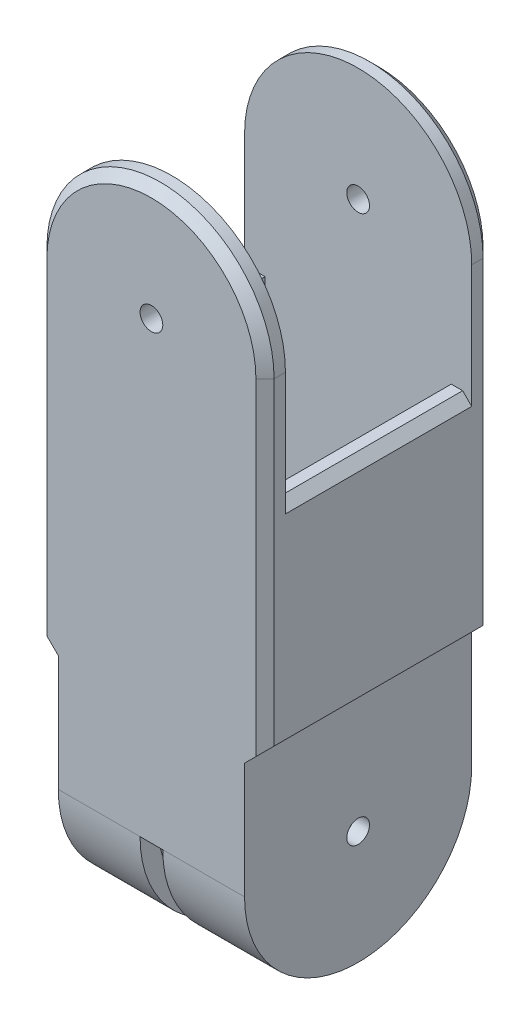
from build123d import *

# Parameters (mm, degrees)
SKETCH1_W               = 50
SKETCH1_H               = 50
BOSS_EXTRUDE1_DEPTH     = 100
SKETCH4_R               = 2.5
BOSS_EXTRUDE2_DEPTH     = 4.5
CUT_EXTRUDE1_DEPTH      = 161.078105936
CUT_EXTRUDE1_DEPTH_BACK = 161.078105936
SKETCH5_R               = 2.5
SKETCH6_W               = 50
SKETCH6_H               = 50
CUT_EXTRUDE2_DEPTH      = 4.5
CHAMFER1_SIZE           = 2
CHAMFER2_SIZE           = 5
SKETCH7_W               = 41
SKETCH7_H               = 41
CUT_EXTRUDE3_DEPTH      = 45
SKETCH8_W               = 34
SKETCH8_H               = 41
CUT_EXTRUDE4_DEPTH      = 30
CUT_EXTRUDE5_DEPTH      = 34
SKETCH10_W              = 5
SKETCH10_H              = 50.266184812
CUT_EXTRUDE6_DEPTH      = 25


with BuildPart() as part:
    # Sketch1 → Boss-Extrude1 (new body)
    with BuildSketch(Plane(origin=(0, 0, 0), x_dir=(1, 0, 0), z_dir=(0, 1, 0))):
        Rectangle(SKETCH1_W, SKETCH1_H)
    extrude(amount=BOSS_EXTRUDE1_DEPTH)

    # Sketch4 → Boss-Extrude2 (add)
    with BuildSketch(Plane(origin=(0, 0, -25), x_dir=(-1, 0, 0), z_dir=(0, 0, -1))):
        with BuildLine():
            Line((-25, 100), (25, 100))
            Line((25, 100), (25, 125))
            ThreePointArc((25, 125), (0, 150), (-25, 125))
            Line((-25, 125), (-25, 100))
        make_face()
        with Locations((0, 125)):
            Circle(SKETCH4_R, mode=Mode.SUBTRACT)
    boss_extrude2 = extrude(amount=-BOSS_EXTRUDE2_DEPTH)

    # Mirror2: Boss-Extrude2 across plane
    add(boss_extrude2.mirror(Plane.XY))

    # Sketch5 → Cut-Extrude1 (cut, two sides: drawn at the far end of the back side and taken through both)
    with BuildSketch(Plane.ZY.offset(-25).offset(-CUT_EXTRUDE1_DEPTH_BACK)):
        with BuildLine():
            Line((-25, 0), (2.6e-08, 0))
            ThreePointArc((2.6e-08, 0), (-17.67766952, 7.322330461), (-25, 25))
            Line((-25, 25), (-25, 0))
        make_face()
        with BuildLine():
            Line((25, 0), (25, 25))
            ThreePointArc((25, 25), (17.677669539, 7.32233048), (2.6e-08, 0))
            Line((2.6e-08, 0), (25, 0))
        make_face()
        with Locations((0, 25)):
            Circle(SKETCH5_R)
    extrude(amount=CUT_EXTRUDE1_DEPTH + CUT_EXTRUDE1_DEPTH_BACK, mode=Mode.SUBTRACT)

    # Sketch6 → Cut-Extrude2 (cut)
    with BuildSketch(Plane(origin=(25, 0, 0), x_dir=(0, 0, -1), z_dir=(1, 0, 0))):
        with Locations((0, 25)):
            Rectangle(SKETCH6_W, SKETCH6_H)
    cut_extrude2 = extrude(amount=-CUT_EXTRUDE2_DEPTH, mode=Mode.SUBTRACT)

    # Mirror3: Cut-Extrude2 across plane
    add(cut_extrude2.mirror(Plane(origin=(0, 0, 0), x_dir=(0, 0, 1), z_dir=(1, 0, 0))), mode=Mode.SUBTRACT)

    # Chamfer1
    chamfer1_edges = [part.edges().sort_by_distance(p)[0] for p in [
        (-25, 100, 0),
        (0, 150, -25),
        (25, 100, 0),
        (0, 150, 25),
        (25, 87.5, 25),
        (-25, 87.5, 25),
        (-25, 87.5, -25),
        (25, 87.5, -25),
    ]]
    chamfer(chamfer1_edges, length=CHAMFER1_SIZE)

    # Chamfer2
    # the kernel refuses this chamfer: 5 mm, written as the material it takes off along each edge
    with BuildSketch(Plane(origin=(25, 50, 35.85841494), x_dir=(0.027495876610586317, 0.9996219169112968, 0), z_dir=(0, 0, -1))) as chamfer2_piece_1_section:
        Polygon((CHAMFER2_SIZE * 0.999621916911, -CHAMFER2_SIZE * 0.0274958766106), (-CHAMFER2_SIZE * 0.0274958766106, -CHAMFER2_SIZE * 0.999621916911), (0, 0), align=None)
    chamfer2_piece_1 = extrude(amount=71.71682988, mode=Mode.PRIVATE)
    chamfer2_piece_1 = split(chamfer2_piece_1, bisect_by=Plane(origin=(20.5, 51.679503735, 0), z_dir=(1, 0, 0)), keep=Keep.TOP, mode=Mode.PRIVATE)
    add(chamfer2_piece_1, mode=Mode.SUBTRACT)
    with BuildSketch(Plane(origin=(-25, 50, 35.85841494), x_dir=(-0.027495876610586317, 0.9996219169112968, 0), z_dir=(0, 0, -1))) as chamfer2_piece_2_section:
        Polygon((CHAMFER2_SIZE * 0.999621916911, CHAMFER2_SIZE * 0.0274958766106), (-CHAMFER2_SIZE * 0.0274958766106, CHAMFER2_SIZE * 0.999621916911), (0, 0), align=None)
    chamfer2_piece_2 = extrude(amount=71.71682988, mode=Mode.PRIVATE)
    chamfer2_piece_2 = split(chamfer2_piece_2, bisect_by=Plane(origin=(-20.5, 51.679503735, 0), z_dir=(-1, 0, 0)), keep=Keep.TOP, mode=Mode.PRIVATE)
    add(chamfer2_piece_2, mode=Mode.SUBTRACT)

    # Sketch7 → Cut-Extrude3 (cut)
    with BuildSketch(Plane(origin=(0, 100, 0), x_dir=(1, 0, 0), z_dir=(0, 1, 0))):
        Rectangle(SKETCH7_W, SKETCH7_H)
    extrude(amount=-CUT_EXTRUDE3_DEPTH, mode=Mode.SUBTRACT)

    # Sketch8 → Cut-Extrude4 (cut)
    with BuildSketch(Plane(origin=(0, 55, 0), x_dir=(1, 0, 0), z_dir=(0, 1, 0))):
        Rectangle(SKETCH8_W, SKETCH8_H)
    extrude(amount=-CUT_EXTRUDE4_DEPTH, mode=Mode.SUBTRACT)

    # Sketch9 → Cut-Extrude5 (cut)
    with BuildSketch(Plane.ZY.offset(-17)):
        with BuildLine():
            Line((-21, 25), (21, 25))
            ThreePointArc((21, 25), (0, 4), (-21, 25))
        make_face()
    extrude(amount=CUT_EXTRUDE5_DEPTH, mode=Mode.SUBTRACT)

    # Sketch10 → Cut-Extrude6 (cut)
    with BuildSketch(Plane(origin=(0, 0, 0), x_dir=(1, 0, 0), z_dir=(0, 1, 0))):
        Rectangle(SKETCH10_W, SKETCH10_H)
    extrude(amount=CUT_EXTRUDE6_DEPTH, mode=Mode.SUBTRACT)


solid = part.part
